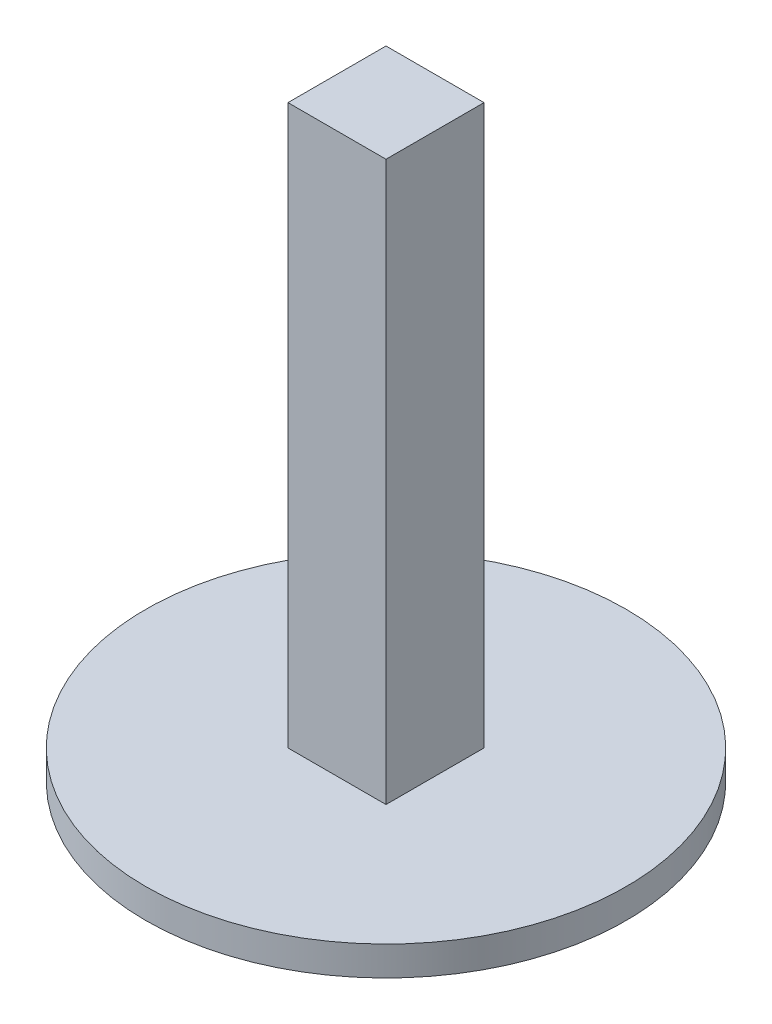
from build123d import *

# Parameters (mm, degrees)
SKETCH1_R           = 6.125
SKETCH1_W           = 2.5
SKETCH1_H           = 2.5
BOSS_EXTRUDE1_DEPTH = 0.75
SKETCH1_2_W         = 2.5
SKETCH1_2_H         = 2.5
BOSS_EXTRUDE2_DEPTH = 15


with BuildPart() as part:
    # Sketch1 → Boss-Extrude1 (new body)
    with BuildSketch(Plane(origin=(0, 0, 0), x_dir=(1, 0, 0), z_dir=(0, 1, 0))):
        Circle(SKETCH1_R)
        Rectangle(SKETCH1_W, SKETCH1_H, mode=Mode.SUBTRACT)
    extrude(amount=BOSS_EXTRUDE1_DEPTH)

    # Sketch1<2> → Boss-Extrude2 (add)
    with BuildSketch(Plane(origin=(0, 0, 0), x_dir=(1, 0, 0), z_dir=(0, 1, 0))):
        Rectangle(SKETCH1_2_W, SKETCH1_2_H)
    extrude(amount=BOSS_EXTRUDE2_DEPTH)


solid = part.part
